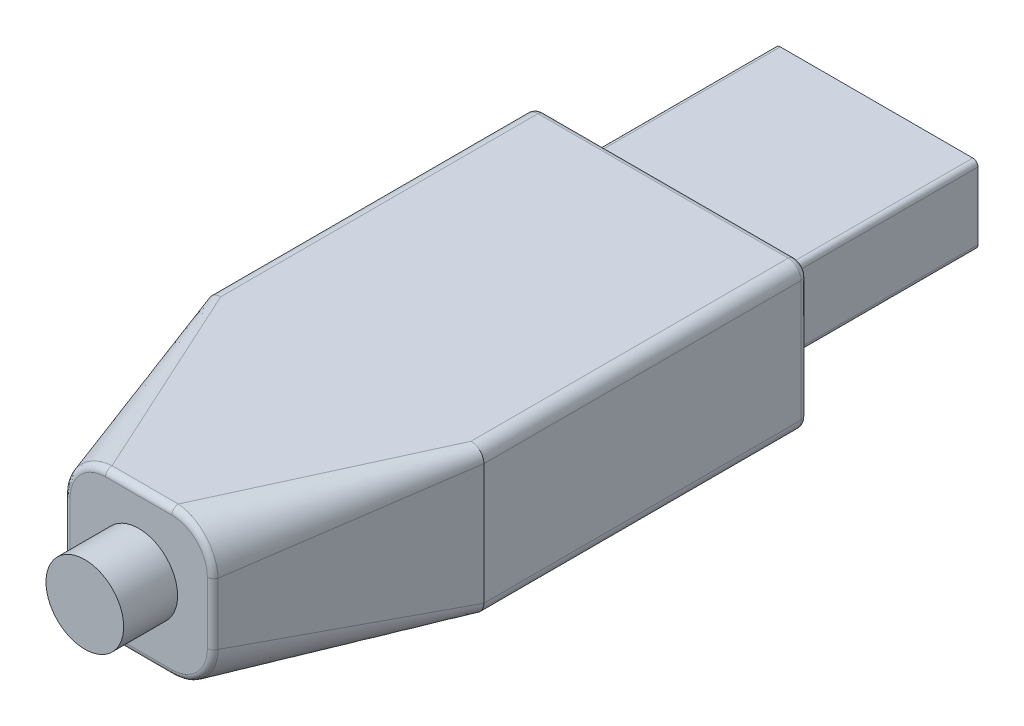
from build123d import *

# Parameters (mm, degrees)
SKETCH14_R           = 2.286
BOSS_EXTRUDE11_DEPTH = 3.175
BOSS_EXTRUDE13_DEPTH = 19.05
SKETCH24_W           = 11.938
SKETCH24_H           = 4.572
BOSS_EXTRUDE14_DEPTH = 12.192
SKETCH25_W           = 11.43
SKETCH25_H           = 2.286
CUT_EXTRUDE3_DEPTH   = 10.16
FILLET8_R            = 0.381
FILLET9_R            = 0.381
FILLET11_R           = 0.3048


with BuildPart() as part:
    # Sketch14 → Boss-Extrude11 (new body)
    with BuildSketch(Plane(origin=(0, 0, 101.6), x_dir=(0.9999999999945706, 3.2953024228087874e-06, 0), z_dir=(0, 2.2118574234716292e-10, 1.0))):
        with Locations((-114.300004308, 16.1798)):
            Circle(SKETCH14_R)
    extrude(amount=-BOSS_EXTRUDE11_DEPTH)

    # Sketch21 for Boss-Loft1 → Boss-Loft1 section 0
    with BuildSketch(Plane(origin=(0, 2.2e-08, 98.425), x_dir=(-1, 0, 0), z_dir=(0, -2.2118574234716292e-10, -1.0))):
        with BuildLine():
            Line((112.522057625, 20.497423324), (116.078057625, 20.497423324))
            # circular arc as an exact rational Bezier (weights 1, cos(half-angle), 1)
            Bezier((116.078057625, 20.497423324), (118.618057625, 20.497423324), (118.618057625, 17.957423324), weights=[1, 0.707106781, 1])
            Line((118.618057625, 17.957423324), (118.618057625, 14.401423324))
            Bezier((118.618057625, 14.401423324), (118.618057625, 11.861423324), (116.078057625, 11.861423324), weights=[1, 0.707106781, 1])
            Line((116.078057625, 11.861423324), (112.522057625, 11.861423324))
            Bezier((112.522057625, 11.861423324), (109.982057625, 11.861423324), (109.982057625, 14.401423324), weights=[1, 0.707106781, 1])
            Line((109.982057625, 14.401423324), (109.982057625, 17.957423324))
            Bezier((109.982057625, 17.957423324), (109.982057625, 20.497423324), (112.522057625, 20.497423324), weights=[1, 0.707106781, 1])
        make_face()
    # Sketch22 for Boss-Loft1 → Boss-Loft1 section 1
    with BuildSketch(Plane(origin=(0, 1.9e-08, 86.233), x_dir=(-1, 0, 0), z_dir=(0, -2.2118574234716292e-10, -1.0))):
        with BuildLine():
            Line((106.934057625, 20.497423324), (121.666057625, 20.497423324))
            Bezier((121.666057625, 20.497423324), (122.428057625, 20.497423324), (122.428057625, 19.735423324), weights=[1, 0.707106781, 1])
            Line((122.428057625, 19.735423324), (122.428057625, 12.623423324))
            Bezier((122.428057625, 12.623423324), (122.428057625, 11.861423324), (121.666057625, 11.861423324), weights=[1, 0.707106781, 1])
            Line((121.666057625, 11.861423324), (106.934057625, 11.861423324))
            Bezier((106.934057625, 11.861423324), (106.172057625, 11.861423324), (106.172057625, 12.623423324), weights=[1, 0.707106781, 1])
            Line((106.172057625, 12.623423324), (106.172057625, 19.735423324))
            Bezier((106.172057625, 19.735423324), (106.172057625, 20.497423324), (106.934057625, 20.497423324), weights=[1, 0.707106781, 1])
        make_face()
    loft()

    # Sketch23 → Boss-Extrude13 (add)
    with BuildSketch(Plane(origin=(0, 1.9e-08, 86.233), x_dir=(-1, 0, 0), z_dir=(0, -2.2118574234716292e-10, -1.0))):
        with BuildLine():
            Line((122.428057625, 12.623423324), (122.428057625, 19.735423324))
            ThreePointArc((122.428057625, 19.735423324), (122.204872992, 20.274238692), (121.666057625, 20.497423324))
            Line((121.666057625, 20.497423324), (106.934057625, 20.497423324))
            ThreePointArc((106.934057625, 20.497423324), (106.395242258, 20.274238692), (106.172057625, 19.735423324))
            Line((106.172057625, 19.735423324), (106.172057625, 12.623423324))
            ThreePointArc((106.172057625, 12.623423324), (106.395242258, 12.084607957), (106.934057625, 11.861423324))
            Line((106.934057625, 11.861423324), (121.666057625, 11.861423324))
            ThreePointArc((121.666057625, 11.861423324), (122.204872992, 12.084607957), (122.428057625, 12.623423324))
        make_face()
    extrude(amount=BOSS_EXTRUDE13_DEPTH)

    # Sketch24 → Boss-Extrude14 (add)
    with BuildSketch(Plane(origin=(0, 1.5e-08, 67.183), x_dir=(-1, 0, 0), z_dir=(0, -2.2118574234716292e-10, -1.0))):
        with Locations((114.300057625, 16.179423324)):
            Rectangle(SKETCH24_W, SKETCH24_H)
    extrude(amount=BOSS_EXTRUDE14_DEPTH)

    # Sketch25 → Cut-Extrude3 (cut)
    with BuildSketch(Plane(origin=(0, 1.2e-08, 54.991), x_dir=(-1, 0, 0), z_dir=(0, -2.2118634934702183e-10, -1.0))):
        with Locations((114.300057625, 15.417423324)):
            Rectangle(SKETCH25_W, SKETCH25_H)
    extrude(amount=-CUT_EXTRUDE3_DEPTH, mode=Mode.SUBTRACT)

    # Fillet8
    fillet8_edges = [part.edges().sort_by_distance(p)[0] for p in [
        (-110.72600661, 19.753474779, 98.424999996),
        (-109.982057625, 16.179423346, 98.424999996),
        (-110.726006192, 12.605372331, 98.424999997),
        (-114.300057625, 20.497423346, 98.424999995),
        (-117.874109058, 19.753474361, 98.424999996),
        (-118.618057625, 16.179423346, 98.424999996),
        (-117.874108641, 12.605371913, 98.424999997),
        (-114.300057625, 11.861423346, 98.424999997),
    ]]
    fillet(fillet8_edges, radius=FILLET8_R)

    # Fillet9
    fillet9_edges = [part.edges().sort_by_distance(p)[0] for p in [
        (-114.300057625, 20.497423339, 67.182999995),
        (-106.395242258, 20.274238706, 67.182999996),
        (-106.172057625, 16.179423339, 67.182999996),
        (-106.395242258, 12.084607972, 67.182999997),
        (-114.300057625, 11.861423339, 67.182999997),
        (-122.204872992, 12.084607972, 67.182999997),
        (-122.428057625, 16.179423339, 67.182999996),
        (-122.204872992, 20.274238706, 67.182999996),
    ]]
    fillet(fillet9_edges, radius=FILLET9_R)

    # Fillet11
    fillet11_edges = [part.edges().sort_by_distance(p)[0] for p in [
        (-108.331057625, 18.465423338, 61.086999996),
        (-108.331057625, 13.893423338, 61.086999997),
        (-120.269057625, 13.893423338, 61.086999997),
        (-120.269057625, 18.465423338, 61.086999996),
    ]]
    fillet(fillet11_edges, radius=FILLET11_R)


solid = part.part
